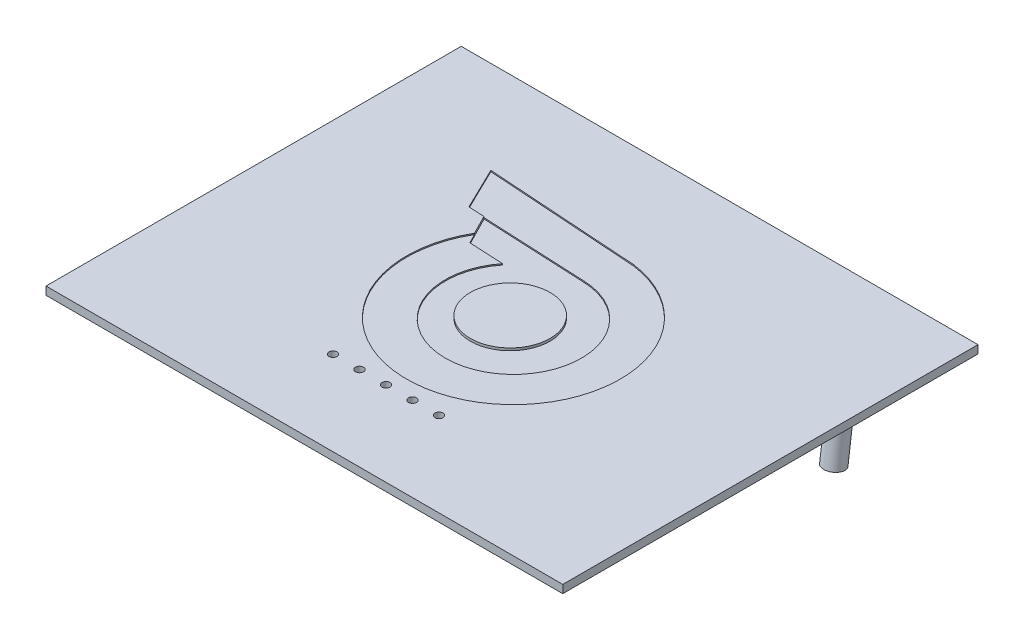
from build123d import *

# Parameters (mm, degrees)
SKETCH1_W                      = 128
SKETCH1_H                      = 101
BOSS_EXTRUDE1_DEPTH            = 2
SKETCH2_W                      = 1.2
SKETCH2_H                      = 98
BOSS_EXTRUDE2_DEPTH            = 1
SKETCH3_W                      = 128
SKETCH3_H                      = 2
BOSS_EXTRUDE3_DEPTH            = 0.48
SKETCH4_W                      = 128
SKETCH4_H                      = 2
BOSS_EXTRUDE4_DEPTH            = 1.37
BOSS_EXTRUDE5_START            = 2
SKETCH5_R                      = 2.5
BOSS_EXTRUDE5_DEPTH            = 13
M3_CLEARANCE_HOLE1_D           = 3.4
M3_CLEARANCE_HOLE1_DEPTH       = 10
M3_CLEARANCE_HOLE1_CSINK_D     = 3.45
M3_CLEARANCE_HOLE1_CSINK_ANGLE = 90
M3_CLEARANCE_HOLE1_TIP         = 1.021463052
M3_CLEARANCE_HOLE2_D           = 3.4
M3_CLEARANCE_HOLE2_DEPTH       = 10
M3_CLEARANCE_HOLE2_CSINK_D     = 3.45
M3_CLEARANCE_HOLE2_CSINK_ANGLE = 90
M3_CLEARANCE_HOLE2_TIP         = 1.021463052
SKETCH14_R                     = 1
CUT_EXTRUDE1_DEPTH             = 5
CUT_EXTRUDE2_DEPTH             = 0.4
CUT_EXTRUDE4_DEPTH             = 0.3
CUT_EXTRUDE5_DEPTH             = 0.6
BOSS_EXTRUDE13_START           = 0.2
SKETCH30_R                     = 9.871633986
BOSS_EXTRUDE13_DEPTH           = 0.6


with BuildPart() as part:
    # Sketch1 → Boss-Extrude1 (new body)
    with BuildSketch(Plane(origin=(0, 0, 0), x_dir=(1, 0, 0), z_dir=(0, 1, 0))):
        Rectangle(SKETCH1_W, SKETCH1_H)
    extrude(amount=BOSS_EXTRUDE1_DEPTH)

    # Sketch2 → Boss-Extrude2 (add)
    with BuildSketch(Plane.XZ):
        with Locations((62.3, 0)):
            Rectangle(SKETCH2_W, SKETCH2_H)
        with Locations((-62.3, 0)):
            Rectangle(SKETCH2_W, SKETCH2_H)
    extrude(amount=BOSS_EXTRUDE2_DEPTH)

    # Sketch3 → Boss-Extrude3 (add)
    with BuildSketch(Plane.XY.offset(50.5)):
        with Locations((0, 1)):
            Rectangle(SKETCH3_W, SKETCH3_H)
    extrude(amount=BOSS_EXTRUDE3_DEPTH)

    # Sketch4 → Boss-Extrude4 (add)
    with BuildSketch(Plane(origin=(0, 0, -50.5), x_dir=(-1, 0, 0), z_dir=(0, 0, -1))):
        with Locations((0, 1)):
            Rectangle(SKETCH4_W, SKETCH4_H)
    extrude(amount=BOSS_EXTRUDE4_DEPTH)

    # Sketch5 → Boss-Extrude5 (add)
    with BuildSketch(Plane(origin=(0, -10.49000593, 1.363700771), x_dir=(1, 0, 0), z_dir=(0, 0.9916556173432378, -0.12891523025462098)).offset(BOSS_EXTRUDE5_START)):
        with Locations((-58.458852689, 22.897883804)):
            Circle(SKETCH5_R)
        with Locations((58.541147311, 22.897883804)):
            Circle(SKETCH5_R)
    extrude(amount=BOSS_EXTRUDE5_DEPTH)

    # M3 Clearance Hole1
    with Locations(Plane(origin=(0, -8.506694695, 1.10587031), x_dir=(1, 0, 0), z_dir=(0, -0.9916556173432378, 0.12891523025462098))):
        with Locations((58.541147311, -22.897883804)):
            CounterSinkHole(M3_CLEARANCE_HOLE1_D / 2, M3_CLEARANCE_HOLE1_CSINK_D / 2, depth=M3_CLEARANCE_HOLE1_DEPTH, counter_sink_angle=M3_CLEARANCE_HOLE1_CSINK_ANGLE)
            with Locations((0, 0, -(M3_CLEARANCE_HOLE1_DEPTH + M3_CLEARANCE_HOLE1_TIP / 2))):  # 118° drill point
                Cone(0, M3_CLEARANCE_HOLE1_D / 2, M3_CLEARANCE_HOLE1_TIP, mode=Mode.SUBTRACT)

    # M3 Clearance Hole2
    with Locations(Plane(origin=(0, -8.506694695, 1.10587031), x_dir=(1, 0, 0), z_dir=(0, -0.9916556173432378, 0.12891523025462098))):
        with Locations((-58.458852689, -22.942113023)):
            CounterSinkHole(M3_CLEARANCE_HOLE2_D / 2, M3_CLEARANCE_HOLE2_CSINK_D / 2, depth=M3_CLEARANCE_HOLE2_DEPTH, counter_sink_angle=M3_CLEARANCE_HOLE2_CSINK_ANGLE)
            with Locations((0, 0, -(M3_CLEARANCE_HOLE2_DEPTH + M3_CLEARANCE_HOLE2_TIP / 2))):  # 118° drill point
                Cone(0, M3_CLEARANCE_HOLE2_D / 2, M3_CLEARANCE_HOLE2_TIP, mode=Mode.SUBTRACT)

    # Sketch14 → Cut-Extrude1 (cut)
    with BuildSketch(Plane.XZ):
        with Locations((-7.272305842, 30.05428165)):
            Circle(SKETCH14_R)
        with Locations((5.854600465, 30.05428165)):
            Circle(SKETCH14_R)
        with Locations((12.418053618, 30.05428165)):
            Circle(SKETCH14_R)
        with Locations((-13.835758996, 30.05428165)):
            Circle(SKETCH14_R)
        with Locations((-0.708852689, 30.05428165)):
            Circle(SKETCH14_R)
    extrude(amount=-CUT_EXTRUDE1_DEPTH, mode=Mode.SUBTRACT)

    # Sketch15 → Cut-Extrude2 (cut)
    with BuildSketch(Plane.XZ):
        Polygon((-16.43147406, 32.05428165), (14.761074601, 32.05428165), (19.761074601, 32.05428165), (19.761074601, 28.05428165), (14.761074601, 28.05428165), (-16.43147406, 28.05428165), (-21.43147406, 28.05428165), (-21.43147406, 32.05428165), align=None)
    extrude(amount=-CUT_EXTRUDE2_DEPTH, mode=Mode.SUBTRACT)

    # Sketch31 → Cut-Extrude4 (cut)
    with BuildSketch(Plane(origin=(0, 2, 0), x_dir=(1, 0, 0), z_dir=(0, 1, 0))):
        with BuildLine():
            Line((-33.728570153, 28.933648051), (4.13413153, 26.393561246))
            ThreePointArc((4.13413153, 26.393561246), (9.760183582, -24.667386725), (-19.013828906, 17.887625608))
            Line((-19.013828906, 17.887625608), (-28.598758166, 18.37901004))
            Line((-28.598758166, 18.37901004), (-33.728570153, 28.933648051))
        make_face()
    extrude(amount=-CUT_EXTRUDE4_DEPTH, mode=Mode.SUBTRACT)

    # Sketch29 → Cut-Extrude5 (cut)
    with BuildSketch(Plane(origin=(0, 2, 0), x_dir=(1, 0, 0), z_dir=(0, 1, 0))):
        with BuildLine():
            Line((-24.723286839, 18.244979768), (1.358452507, 17.015990261))
            ThreePointArc((1.358452507, 17.015990261), (7.637751616, -15.173520729), (-12.570060524, 10.657440221))
            Line((-12.570060524, 10.657440221), (-21.080049426, 11.093716374))
            Line((-21.080049426, 11.093716374), (-24.723286839, 18.244979768))
        make_face()
    extrude(amount=-CUT_EXTRUDE5_DEPTH, mode=Mode.SUBTRACT)


with BuildPart() as body_2:
    # Sketch30 → Boss-Extrude13 (new body)
    with BuildSketch(Plane(origin=(0, 2, 0), x_dir=(1, 0, 0), z_dir=(0, 1, 0)).offset(BOSS_EXTRUDE13_START)):
        Circle(SKETCH30_R)
    extrude(amount=-BOSS_EXTRUDE13_DEPTH)


solid = Compound([part.part, body_2.part])
